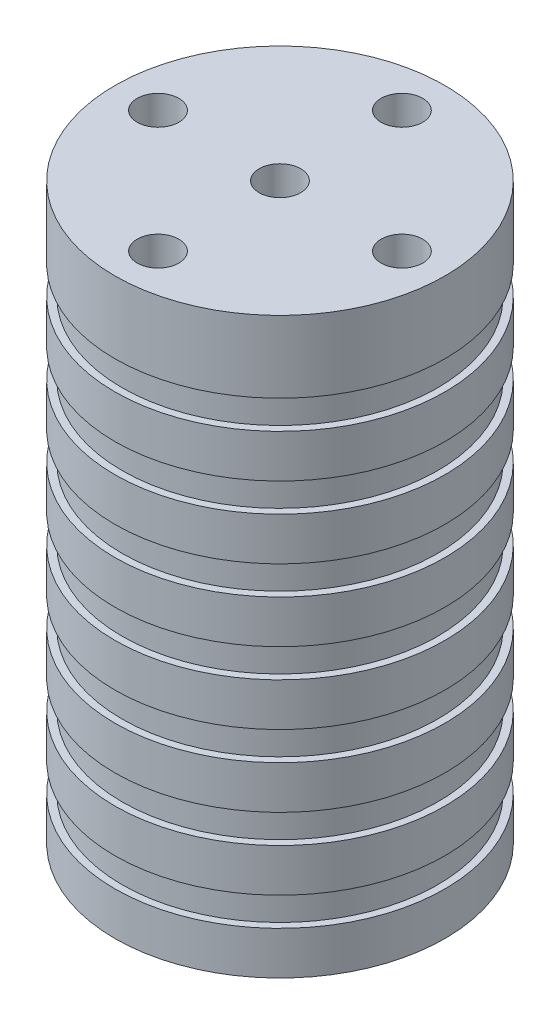
from build123d import *

# Parameters (mm, degrees)
SKETCH3_W                   = 0.5
SKETCH3_H                   = 2
LPATTERN1_COUNT             = 7
LPATTERN1_PITCH             = 5
M3_5X0_6_TAPPED_HOLE1_D     = 2.9
M3_5X0_6_TAPPED_HOLE1_DEPTH = 10
M3_5X0_6_TAPPED_HOLE1_TIP   = 0.871247898


with BuildPart() as part:
    # Sketch2 → Revolve1 (revolve)
    with BuildSketch(Plane.XY):
        Polygon((0, 0), (-11.5, 0), (-11.5, -40), (-5.5, -40), (-5.5, -7), (0, -7), align=None)
    revolve(axis=Axis((0, 0, 0), (0, -1, 0)))

    # Sketch3 → Cut-Revolve1 (revolve, cut)
    with BuildSketch(Plane.XY):
        with Locations((11.25, -36)):
            Rectangle(SKETCH3_W, SKETCH3_H)
    cut_revolve1 = revolve(axis=Axis((0, 0, 0), (0, -1, 0)), mode=Mode.SUBTRACT)

    # LPattern1: Cut-Revolve1 ×7
    with Locations(*[(0, i * LPATTERN1_PITCH, 0) for i in range(1, LPATTERN1_COUNT)]):
        add(cut_revolve1, mode=Mode.SUBTRACT)

    # M3.5x0.6 Tapped Hole1
    with Locations(Plane(origin=(0, 0, 0), x_dir=(1, 0, 0), z_dir=(0, 1, 0))):
        with Locations((8.5, 0), (0, 0), (-8.5, 0), (0, 8.5), (0, -8.5)):
            Hole(M3_5X0_6_TAPPED_HOLE1_D / 2, depth=M3_5X0_6_TAPPED_HOLE1_DEPTH)
            with Locations((0, 0, -(M3_5X0_6_TAPPED_HOLE1_DEPTH + M3_5X0_6_TAPPED_HOLE1_TIP / 2))):  # 118° drill point
                Cone(0, M3_5X0_6_TAPPED_HOLE1_D / 2, M3_5X0_6_TAPPED_HOLE1_TIP, mode=Mode.SUBTRACT)


solid = part.part
